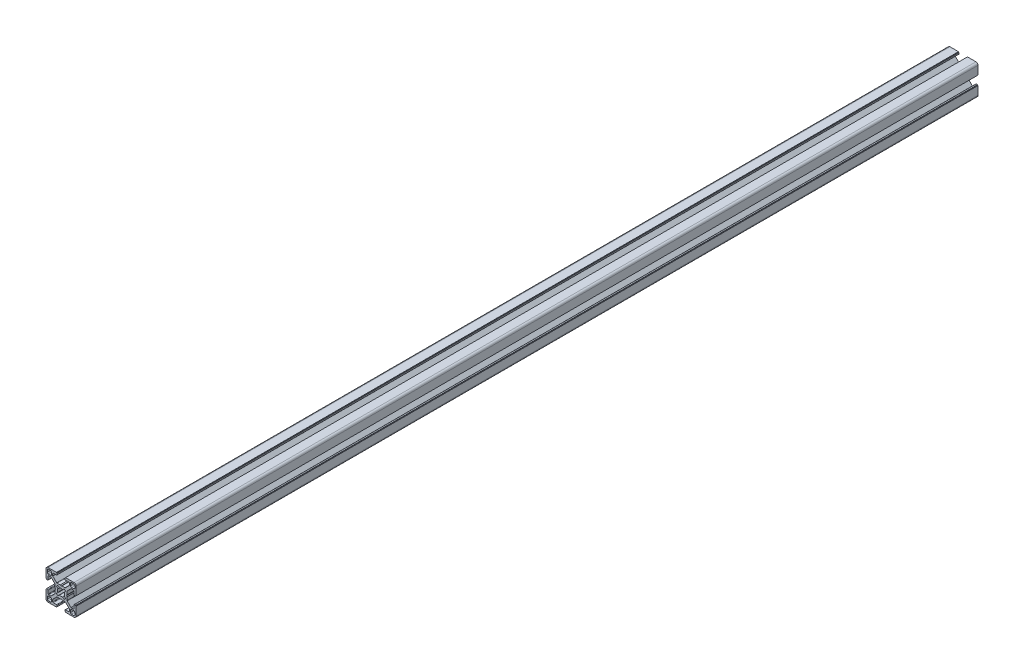
from build123d import *

# Parameters (mm, degrees)
BOSS_EXTRUDE1_DEPTH = 450
CIRPATTERN1_COUNT   = 4


with BuildPart() as part:
    # Sketch3 → Boss-Extrude1 (new, symmetric)
    with BuildSketch(Plane.XY):
        with BuildLine():
            Line((-4.503841895, 3.156803476), (-3.14772708, 1.530298739))
            ThreePointArc((-3.14772708, 1.530298739), (-3.410794979, 0.785160882), (-3.5, 0))
            Line((-3.5, 0), (-5.5, 0))
            Line((-5.5, 0), (-6, 0.866025404))
            Line((-6, 0.866025404), (-6, 3.996841995))
            ThreePointArc((-6, 3.996841995), (-6.038060234, 4.188183711), (-6.146446609, 4.350395385))
            Line((-6.146446609, 4.350395385), (-9.917104615, 8.121053391))
            ThreePointArc((-9.917104615, 8.121053391), (-10.079316289, 8.229439766), (-10.270658005, 8.2675))
            Line((-10.270658005, 8.2675), (-12.29, 8.2675))
            ThreePointArc((-12.29, 8.2675), (-12.643553391, 8.121053391), (-12.79, 7.7675))
            Line((-12.79, 7.7675), (-12.79, 4.5))
            ThreePointArc((-12.79, 4.5), (-12.936446609, 4.146446609), (-13.29, 4))
            Line((-13.29, 4), (-14.5, 4))
            Line((-14.5, 4), (-14.5, 4.5))
            Line((-14.5, 4.5), (-15, 4.5))
            Line((-15, 4.5), (-15, 12.968))
            ThreePointArc((-15, 12.968), (-14.404840979, 14.404840979), (-12.968, 15))
            Line((-12.968, 15), (-4.5, 15))
            Line((-4.5, 15), (-4.5, 14.5))
            Line((-4.5, 14.5), (-4, 14.5))
            Line((-4, 14.5), (-4, 13.29))
            ThreePointArc((-4, 13.29), (-4.146446609, 12.936446609), (-4.5, 12.79))
            Line((-4.5, 12.79), (-7.7675, 12.79))
            ThreePointArc((-7.7675, 12.79), (-8.121053391, 12.643553391), (-8.2675, 12.29))
            Line((-8.2675, 12.29), (-8.2675, 10.270658005))
            ThreePointArc((-8.2675, 10.270658005), (-8.229439766, 10.079316289), (-8.121053391, 9.917104615))
            Line((-8.121053391, 9.917104615), (-4.350395385, 6.146446609))
            ThreePointArc((-4.350395385, 6.146446609), (-4.188183711, 6.038060234), (-3.996841995, 6))
            Line((-3.996841995, 6), (-0.866025404, 6))
            Line((-0.866025404, 6), (0, 5.5))
            Line((0, 5.5), (0, 3.5))
            ThreePointArc((0, 3.5), (-0.785160882, 3.410794979), (-1.530298739, 3.14772708))
            Line((-1.530298739, 3.14772708), (-3.156803476, 4.503841895))
            ThreePointArc((-3.156803476, 4.503841895), (-3.889087297, 3.889087297), (-4.503841895, 3.156803476))
        make_face()
        with BuildLine():
            Line((-12.705, 9.5135), (-10.5135, 9.5135))
            ThreePointArc((-10.5135, 9.5135), (-9.806393219, 9.806393219), (-9.5135, 10.5135))
            Line((-9.5135, 10.5135), (-9.5135, 12.705))
            ThreePointArc((-9.5135, 12.705), (-9.806393219, 13.412106781), (-10.5135, 13.705))
            Line((-10.5135, 13.705), (-12.705, 13.705))
            ThreePointArc((-12.705, 13.705), (-13.412106781, 13.412106781), (-13.705, 12.705))
            Line((-13.705, 12.705), (-13.705, 10.5135))
            ThreePointArc((-13.705, 10.5135), (-13.412106781, 9.806393219), (-12.705, 9.5135))
        make_face(mode=Mode.SUBTRACT)
    boss_extrude1 = extrude(amount=BOSS_EXTRUDE1_DEPTH, both=True)

    # CirPattern1: Boss-Extrude1 ×4 about axis
    cirpattern1_axis = Axis((0, 0, 76.2), (0, 0, -1))
    for i in range(1, CIRPATTERN1_COUNT):
        add(boss_extrude1.rotate(cirpattern1_axis, i * 360 / CIRPATTERN1_COUNT))


solid = part.part
